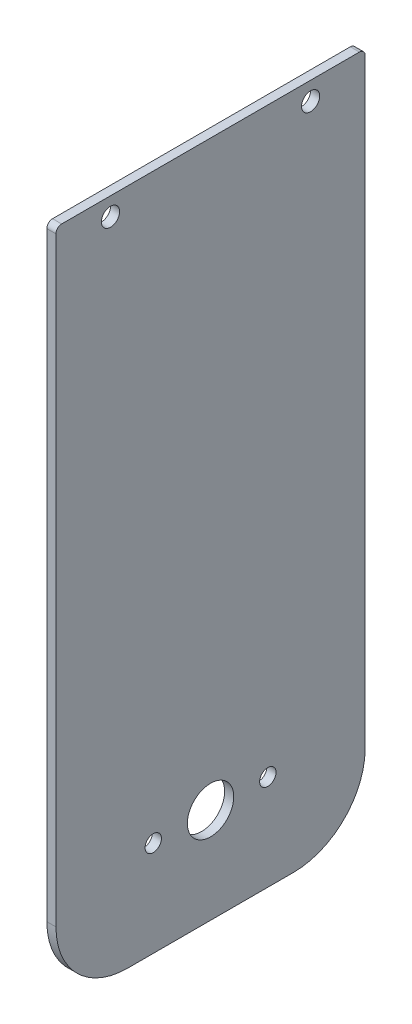
from build123d import *

# Parameters (mm, degrees)
SKETCH1_W           = 107.95
SKETCH1_H           = 236.535
SKETCH1_R           = 8.1
SKETCH1_R_2         = 2.86
SKETCH1_R_3         = 3.175
BOSS_EXTRUDE1_DEPTH = 3.175
FILLET1_R           = 25
FILLET2_R           = 2


with BuildPart() as part:
    # Sketch1 → Boss-Extrude1 (new body)
    with BuildSketch(Plane(origin=(0, 0, 0), x_dir=(0, 0, -1), z_dir=(1, 0, 0))):
        Rectangle(SKETCH1_W, SKETCH1_H)
        with Locations((0, -84.9275)):
            Circle(SKETCH1_R, mode=Mode.SUBTRACT)
        with Locations((20, -84.9275)):
            Circle(SKETCH1_R_2, mode=Mode.SUBTRACT)
        with Locations((-20, -84.9275)):
            Circle(SKETCH1_R_2, mode=Mode.SUBTRACT)
        with Locations((-34.925, 111.9175)):
            Circle(SKETCH1_R_3, mode=Mode.SUBTRACT)
        with Locations((34.925, 111.9175)):
            Circle(SKETCH1_R_3, mode=Mode.SUBTRACT)
    extrude(amount=BOSS_EXTRUDE1_DEPTH)

    # Fillet1
    fillet1_edges = [part.edges().sort_by_distance(p)[0] for p in [
        (1.5875, -118.2675, 53.975),
        (1.5875, -118.2675, -53.975),
    ]]
    fillet(fillet1_edges, radius=FILLET1_R)

    # Fillet2
    fillet2_edges = [part.edges().sort_by_distance(p)[0] for p in [
        (1.5875, 118.2675, 53.975),
        (1.5875, 118.2675, -53.975),
    ]]
    fillet(fillet2_edges, radius=FILLET2_R)


solid = part.part
